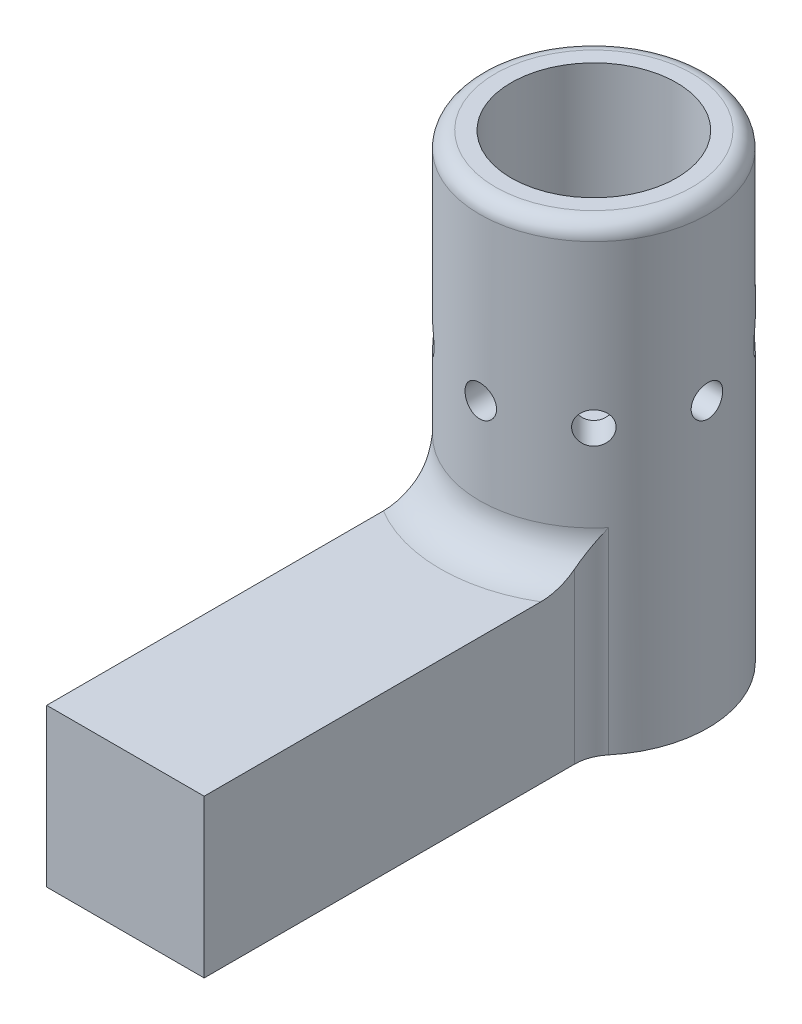
from build123d import *

# Parameters (mm, degrees)
EXTRUDE_2_DEPTH                = 53
EXTRUDE_2_DEPTH_BACK           = 5.5
SKETCH_2_R                     = 14.5
SKETCH_1_W                     = 20
SKETCH_1_H                     = 20
EXTRUDE_3_DEPTH                = 59.5
SKETCH_3_R                     = 10.5
CUT_EXTRUDE_1_DEPTH            = 38
FILLET_2_R                     = 2
SKETCH_4_R                     = 2
CUT_EXTRUDE_2_DEPTH            = 30
PATTERN_START                  = -14.500000084
PATTERN_CIRCULAR_2_OUTLINE_R   = 2
PATTERN_CIRCULAR_2_DEPTH       = 29.000000168
PATTERN_CIRCULAR_2_2_OUTLINE_R = 2
PATTERN_CIRCULAR_2_2_DEPTH     = 29.000000186
PATTERN_CIRCULAR_2_3_OUTLINE_R = 2
PATTERN_CIRCULAR_2_3_DEPTH     = 29.000000168
FILLET_3_R                     = 5


# Read off the part's stored shape, not the designer's step: Круговой массив2
with BuildPart() as part:
    # Эскиз2 → Бобышка-Вытянуть2 (new, two sides: drawn at the far end of the back side and taken through both)
    with BuildSketch(Plane(origin=(0, 0, 0), x_dir=(1, 0, 0), z_dir=(0, 1, 0)).offset(-EXTRUDE_2_DEPTH_BACK)):
        with Locations(Location((0, 0, 0), (0, 0, 270))):
            Circle(SKETCH_2_R)
    extrude(amount=EXTRUDE_2_DEPTH + EXTRUDE_2_DEPTH_BACK)

    # Эскиз1 → Бобышка-Вытянуть3 (add)
    with BuildSketch(Plane.XY):
        with Locations((0, 4.5)):
            Rectangle(SKETCH_1_W, SKETCH_1_H)
    extrude(amount=EXTRUDE_3_DEPTH)

    # Эскиз3 → Вырез-Вытянуть1 (cut)
    with BuildSketch(Plane(origin=(0, 53, 0), x_dir=(1, 0, 0), z_dir=(0, 1, 0))):
        with Locations(Location((0, 0, 0), (0, 0, 270))):
            Circle(SKETCH_3_R)
    extrude(amount=-CUT_EXTRUDE_1_DEPTH, mode=Mode.SUBTRACT)

    # Скругление2
    fillet_2_edges = [part.edges().sort_by_distance(p)[0] for p in [
        (0, 53, -14.5),
    ]]
    fillet(fillet_2_edges, radius=FILLET_2_R)

    # Эскиз4 → Вырез-Вытянуть2 (cut, symmetric)
    with BuildSketch(Plane(origin=(0, 0, 0), x_dir=(0, 0, -1), z_dir=(1, 0, 0))):
        with Locations(Location((0, 30.5, 0), (0, 0, 180))):
            Circle(SKETCH_4_R)
    extrude(amount=CUT_EXTRUDE_2_DEPTH, both=True, mode=Mode.SUBTRACT)

    # Круговой массив2 outline → Круговой массив2 (cut)
    with BuildSketch(Plane(origin=(0, 0, 0), x_dir=(0.7071067811865438, 0, -0.7071067811865512), z_dir=(0.7071067811865511, 0, 0.7071067811865441)).offset(PATTERN_START)):
        with Locations((0, 30.5)):
            Circle(PATTERN_CIRCULAR_2_OUTLINE_R)
    extrude(amount=PATTERN_CIRCULAR_2_DEPTH, mode=Mode.SUBTRACT)

    # Pattern Circular 2 2 outline → Pattern Circular 2 2 (cut)
    with BuildSketch(Plane.XY.offset(PATTERN_START)):
        with Locations((0, 30.5)):
            Circle(PATTERN_CIRCULAR_2_2_OUTLINE_R)
    extrude(amount=PATTERN_CIRCULAR_2_2_DEPTH, mode=Mode.SUBTRACT)

    # Pattern Circular 2 3 outline → Pattern Circular 2 3 (cut)
    with BuildSketch(Plane(origin=(0, 0, 0), x_dir=(0.707106781186549, 0, 0.707106781186546), z_dir=(0.707106781186546, 0, -0.707106781186549)).offset(PATTERN_START)):
        with Locations((0, -30.5)):
            Circle(PATTERN_CIRCULAR_2_3_OUTLINE_R)
    extrude(amount=PATTERN_CIRCULAR_2_3_DEPTH, mode=Mode.SUBTRACT)

    # Скругление3
    fillet_3_edges = [part.edges().sort_by_distance(p)[0] for p in [
        (-5.385164807, 14.5, 13.462912018),
        (-10, 4.5, 10.5),
        (10, 4.5, 10.5),
    ]]
    fillet(fillet_3_edges, radius=FILLET_3_R)


solid = part.part
